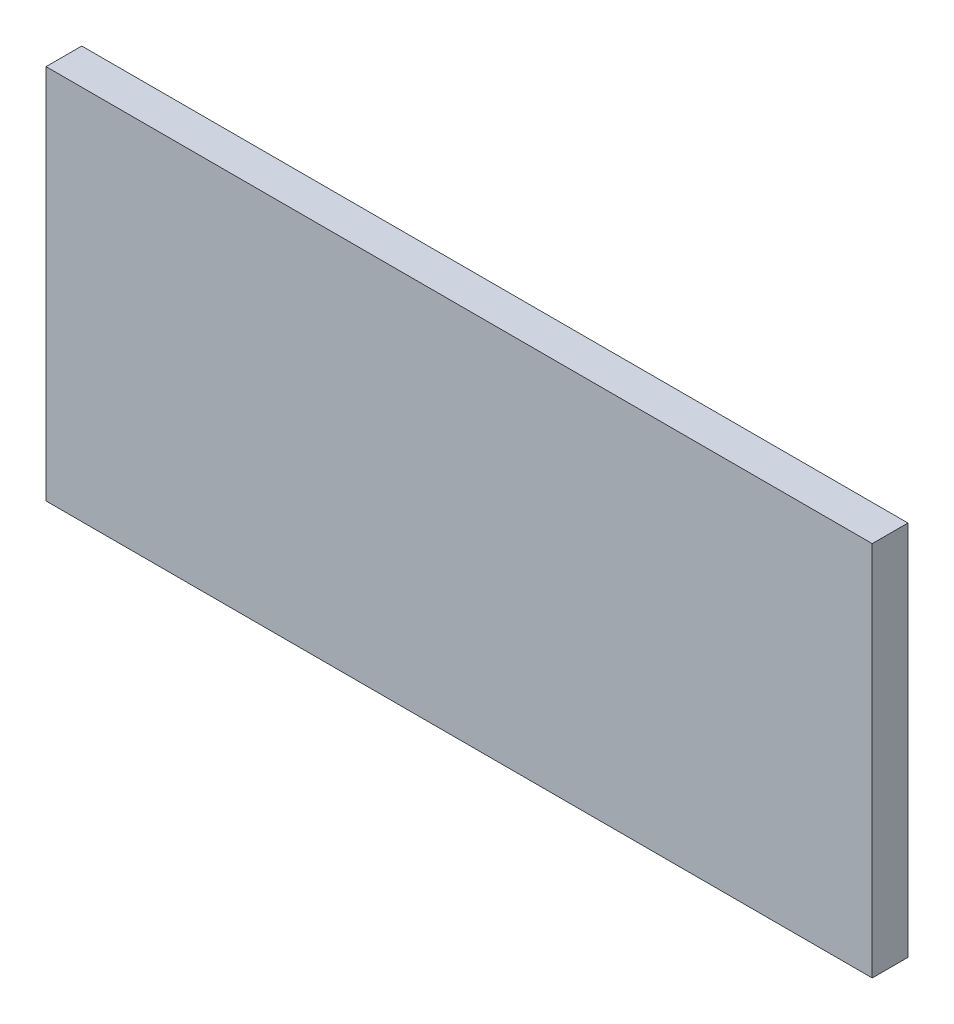
from build123d import *

# Parameters (mm, degrees)
IZIM1_W            = 694
IZIM1_H            = 316
TABAN_FLAN_1_DEPTH = 30


# Sheet-metal steps are written as plain solids
with BuildPart() as part:
    # Çizim1 → Taban-Flanş1 (new body)
    with BuildSketch(Plane.XY):
        with Locations((347, -158)):
            Rectangle(IZIM1_W, IZIM1_H)
    extrude(amount=-TABAN_FLAN_1_DEPTH)


solid = part.part
